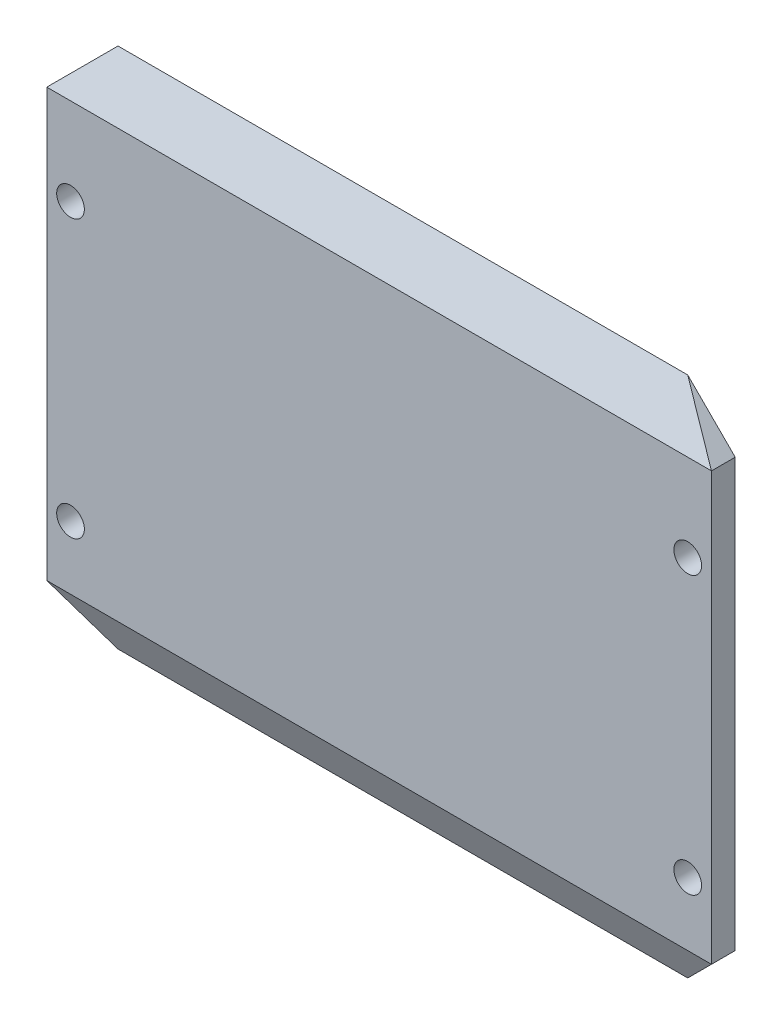
from build123d import *
from OCP.BRepFilletAPI import BRepFilletAPI_MakeChamfer

# Parameters (mm, degrees)
SKETCH1_W           = 84
SKETCH1_H           = 66
BOSS_EXTRUDE1_DEPTH = 3
CHAMFER2_SIZE       = 6
CHAMFER4_SIZE       = 3
CHAMFER4_SIZE_2     = 6
SKETCH2_R           = 1.75
CUT_EXTRUDE1_DEPTH  = 54.4976635


with BuildPart() as part:
    # Sketch1 → Boss-Extrude1 (new body)
    with BuildSketch(Plane.XY):
        Rectangle(SKETCH1_W, SKETCH1_H)
    extrude(amount=BOSS_EXTRUDE1_DEPTH)

    # Chamfer2
    chamfer2_edges = [part.edges().sort_by_distance(p)[0] for p in [
        (42, -33, 1.5),
        (-42, -33, 1.5),
        (-42, 33, 1.5),
        (42, 33, 1.5),
    ]]
    chamfer(chamfer2_edges, length=CHAMFER2_SIZE)

    # Chamfer4
    chamfer4_edges_1 = [part.edges().sort_by_distance(p)[0] for p in [
        (0, -33, 3),
    ]]
    chamfer4_side_1 = [part.faces().sort_by_distance(p)[0] for p in [
        (0, -33, 2.94),
    ]]
    chamfer4_edges_2 = [part.edges().sort_by_distance(p)[0] for p in [
        (0, 33, 3),
    ]]
    chamfer4_side_2 = [part.faces().sort_by_distance(p)[0] for p in [
        (0, 32.94, 3),
    ]]
    chamfer4 = BRepFilletAPI_MakeChamfer(part.part.solid().wrapped)
    for e in chamfer4_edges_1:
        chamfer4.Add(CHAMFER4_SIZE - 0.0001, CHAMFER4_SIZE_2 - 0.0001, e.wrapped, chamfer4_side_1[0].wrapped)
    for e in chamfer4_edges_2:
        chamfer4.Add(CHAMFER4_SIZE_2 - 0.0001, CHAMFER4_SIZE - 0.0001, e.wrapped, chamfer4_side_2[0].wrapped)
    add(Compound.cast(chamfer4.Shape()), mode=Mode.REPLACE)  # a hair under: the kernel refuses the full size

    # Sketch2 → Cut-Extrude1 (cut, through all)
    with BuildSketch(Plane.XY.offset(3)):
        with Locations((-39, -19)):
            Circle(SKETCH2_R)
        with Locations(Location((39, -19, 0), (0, 0, 180))):
            Circle(SKETCH2_R)
        with Locations((39, 16)):
            Circle(SKETCH2_R)
        with Locations(Location((-39, 16, 0), (0, 0, 180))):
            Circle(SKETCH2_R)
    extrude(amount=-CUT_EXTRUDE1_DEPTH, mode=Mode.SUBTRACT)


solid = part.part
